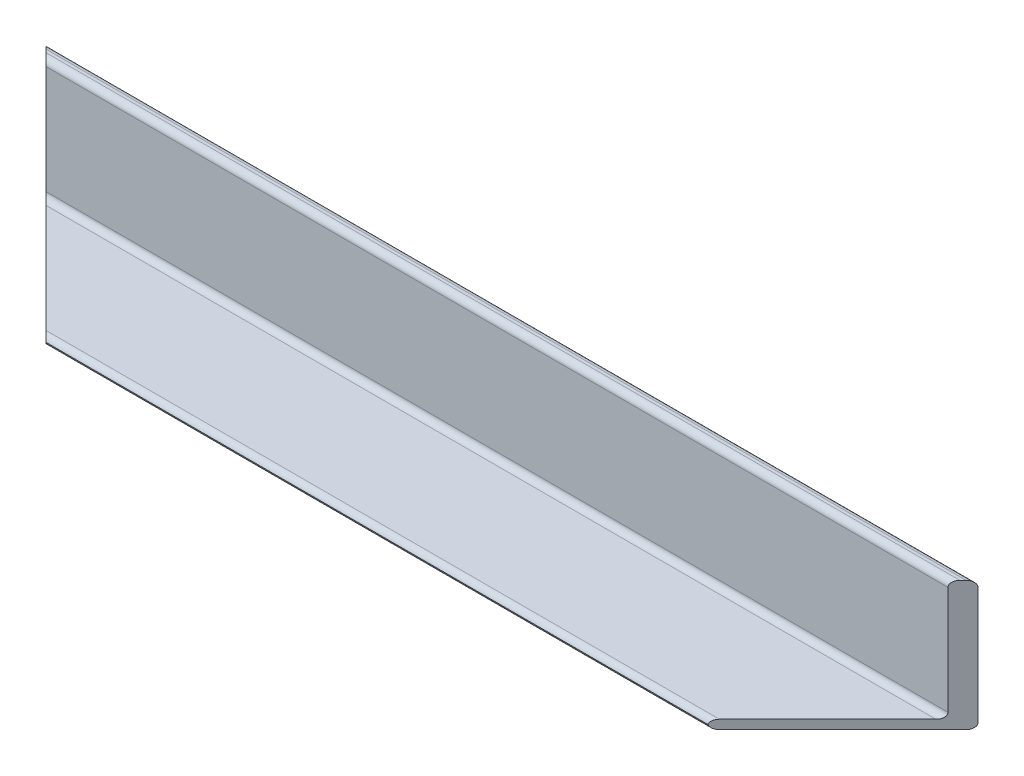
from build123d import *

# Parameters (mm, degrees)
SKETCH1_W           = 155
SKETCH1_H           = 22.5
BOSS_EXTRUDE1_DEPTH = 1.5
SKETCH2_W           = 155
SKETCH2_H           = 2.5
BOSS_EXTRUDE2_DEPTH = 20
CUT_EXTRUDE2_DEPTH  = 82.209990149
FILLET1_R           = 1


with BuildPart() as part:
    # Sketch1 → Boss-Extrude1 (new body)
    with BuildSketch(Plane(origin=(0, 0, 0), x_dir=(1, 0, 0), z_dir=(0, 1, 0))):
        Rectangle(SKETCH1_W, SKETCH1_H)
    extrude(amount=BOSS_EXTRUDE1_DEPTH)

    # Sketch2 → Boss-Extrude2 (add)
    with BuildSketch(Plane(origin=(0, 1.5, 0), x_dir=(1, 0, 0), z_dir=(0, 1, 0))):
        with Locations((0, 10)):
            Rectangle(SKETCH2_W, SKETCH2_H)
    extrude(amount=BOSS_EXTRUDE2_DEPTH)

    # Sketch3 → Cut-Extrude2 (cut, through all)
    with BuildSketch(Plane(origin=(0, 0, 0), x_dir=(-1, 0, 0), z_dir=(0, -1, 0))):
        Polygon((-77.5, -11.25), (-55, -11.25), (-77.5, 11.25), align=None)
        Polygon((77.5, -11.25), (77.5, 11.25), (55, -11.25), align=None)
    extrude(amount=-CUT_EXTRUDE2_DEPTH, mode=Mode.SUBTRACT)

    # Fillet1
    # the kernel refuses this fillet: 1 mm, written as the material it adds along each edge
    with BuildSketch(Plane(origin=(77.5, 1.5, -8.75), x_dir=(0, 0, 1), z_dir=(-1, 0, 0))) as fillet1_piece_1_section:
        with BuildLine():
            CenterArc((FILLET1_R, FILLET1_R), FILLET1_R, 180, 90)
            Line((0, FILLET1_R), (0, 0))
            Line((0, 0), (FILLET1_R, 0))
        make_face()
    fillet1_piece_1 = extrude(amount=155, mode=Mode.PRIVATE)
    fillet1_piece_1 = split(fillet1_piece_1, bisect_by=Plane(origin=(-37.387113225, 1.726762312, 28.862886775), z_dir=(0.7071067811865436, 0, -0.7071067811865515)), keep=Keep.TOP, mode=Mode.PRIVATE)
    fillet1_piece_1 = split(fillet1_piece_1, bisect_by=Plane(origin=(37.387113225, 1.726762312, 28.862886775), z_dir=(-0.7071067811865492, 0, -0.7071067811865458)), keep=Keep.TOP, mode=Mode.PRIVATE)
    add(fillet1_piece_1)
    # the kernel refuses this fillet: 1 mm, written as the material it takes off along each edge
    with BuildSketch(Plane(origin=(-80, 0, -11.25), x_dir=(0, 1, 0), z_dir=(1, 0, 0))) as fillet1_2_piece_1:
        with BuildLine():
            CenterArc((FILLET1_R, FILLET1_R), FILLET1_R, 180, 90)
            Line((0, FILLET1_R), (0, 0))
            Line((0, 0), (FILLET1_R, 0))
        make_face()
    extrude(amount=160, mode=Mode.SUBTRACT)
    with BuildSketch(Plane(origin=(-80, 21.5, -11.25), x_dir=(0, -1, 0), z_dir=(1, 0, 0))) as fillet1_2_piece_2:
        with BuildLine():
            CenterArc((FILLET1_R, -FILLET1_R), FILLET1_R, 90, 90)
            Line((0, -FILLET1_R), (0, 0))
            Line((0, 0), (FILLET1_R, 0))
        make_face()
    extrude(amount=160, mode=Mode.SUBTRACT)
    with BuildSketch(Plane(origin=(57.5, 0, 11.25), x_dir=(0, 0, -1), z_dir=(-1, 0, 0)), Plane(origin=(57.5, 1.5, 11.25), x_dir=(0, -1, 0), z_dir=(-1, 0, 0))) as fillet1_2_piece_3:
        with BuildLine():
            CenterArc((FILLET1_R, -FILLET1_R), FILLET1_R, 90, 90)
            Line((0, -FILLET1_R), (0, 0))
            Line((0, 0), (FILLET1_R, 0))
        make_face()
    extrude(amount=115, mode=Mode.SUBTRACT)
    with BuildSketch(Plane(origin=(77.5, 21.5, -8.75), x_dir=(0, 0, -1), z_dir=(-1, 0, 0))) as fillet1_2_piece_4:
        with BuildLine():
            CenterArc((FILLET1_R, FILLET1_R), FILLET1_R, 180, 90)
            Line((0, FILLET1_R), (0, 0))
            Line((0, 0), (FILLET1_R, 0))
        make_face()
    extrude(amount=155, mode=Mode.SUBTRACT)


solid = part.part
